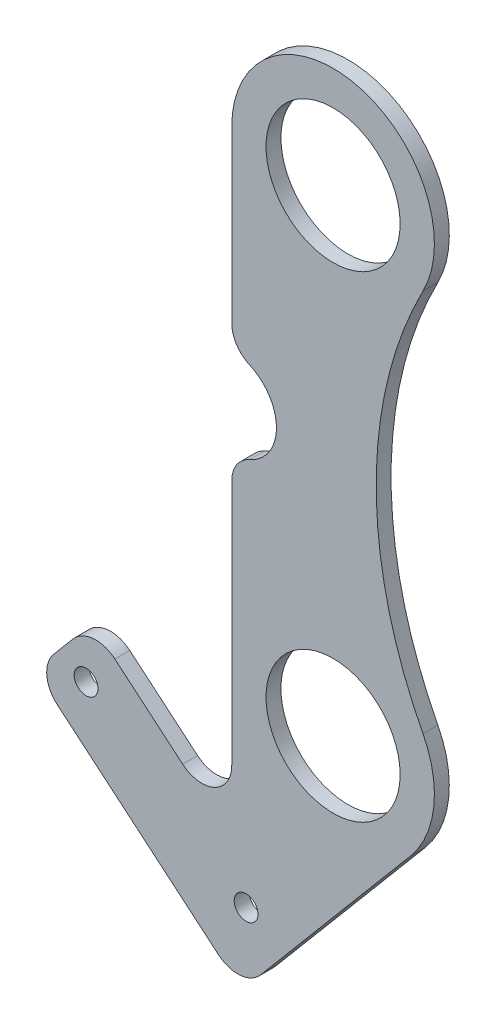
from build123d import *

# Parameters (mm, degrees)
SKETCH1_R           = 14.2875
SKETCH1_R_2         = 2.54
BOSS_EXTRUDE1_DEPTH = 3.175
CUT_EXTRUDE1_DEPTH  = 162.674043733
FILLET3_R           = 6.35
SKETCH3_R           = 2.54
BOSS_EXTRUDE3_DEPTH = 3.175
SKETCH6_R           = 2.54
BOSS_EXTRUDE4_DEPTH = 3.175
FILLET2_R           = 6.35
CUT_EXTRUDE2_DEPTH  = 169.237022961
CUT_EXTRUDE3_DEPTH  = 169.237022961


with BuildPart() as part:
    # Sketch1 → Boss-Extrude1 (new body)
    with BuildSketch(Plane.XY):
        with BuildLine():
            Line((-8.89, 25.4), (8.89, 25.4))
            ThreePointArc((8.89, 25.4), (17.870256121, 21.680256121), (21.59, 12.7))
            Line((21.59, 12.7), (21.59, -117.775079775))
            ThreePointArc((21.59, -117.775079775), (21.127743647, -120.388718212), (19.797058824, -122.685251408))
            Line((19.797058824, -122.685251408), (-7.952696208, -155.616779465))
            ThreePointArc((-7.952696208, -155.616779465), (-12.268297602, -157.851943494), (-16.900388255, -156.380852124))
            Line((-16.900388255, -156.380852124), (-32.439211784, -143.287061102))
            ThreePointArc((-32.439211784, -143.287061102), (-34.674375812, -138.971459708), (-33.203284443, -134.339369055))
            Line((-33.203284443, -134.339369055), (-23.382941176, -122.685251408))
            ThreePointArc((-23.382941176, -122.685251408), (-22.052256353, -120.388718212), (-21.59, -117.775079775))
            Line((-21.59, -117.775079775), (-21.59, 12.7))
            ThreePointArc((-21.59, 12.7), (-17.870256121, 21.680256121), (-8.89, 25.4))
        make_face()
        Circle(SKETCH1_R, mode=Mode.SUBTRACT)
        with Locations((0, -101.6)):
            Circle(SKETCH1_R, mode=Mode.SUBTRACT)
        with Locations((-18.532085478, -142.550133084)):
            Circle(SKETCH1_R_2, mode=Mode.SUBTRACT)
    extrude(amount=BOSS_EXTRUDE1_DEPTH)

    # Sketch2 → Cut-Extrude1 (cut, through all)
    with BuildSketch(Plane.XY):
        with BuildLine():
            ThreePointArc((-21.59, -60.325), (-12.065, -50.8), (-21.59, -41.275))
            Line((-21.59, -41.275), (-21.59, -60.325))
        make_face()
        with BuildLine():
            ThreePointArc((19.159083004, -91.647229609), (21.458203844, -103.981929422), (16.51, -115.512152961))
            Line((16.51, -115.512152961), (-17.501317584, -155.874478972))
            Line((-17.501317584, -155.874478972), (-7.620284479, -163.8572221))
            Line((-7.620284479, -163.8572221), (27.94, -121.656687185))
            Line((27.94, -121.656687185), (27.94, 0))
            Line((27.94, 0), (21.59, 0))
            ThreePointArc((21.59, 0), (20.973467787, -5.122670102), (19.159083004, -9.952770391))
            ThreePointArc((19.159083004, -9.952770391), (9.182340769, -50.8), (19.159083004, -91.647229609))
        make_face()
    extrude(amount=CUT_EXTRUDE1_DEPTH, mode=Mode.SUBTRACT)


with BuildPart() as cut_extrude1_piece_1:
    # of the separate pieces the step leaves, piece 1, a body of its own (cut_extrude1_pieces)
    add(part.part.solids().sort_by_distance((-8.89, 25.4, 0))[0])

    # Fillet3
    fillet3_edges = [cut_extrude1_piece_1.edges().sort_by_distance(p)[0] for p in [
        (-21.59, -41.275, 1.5875),
        (-21.59, -60.325, 1.5875),
    ]]
    fillet(fillet3_edges, radius=FILLET3_R)

    # Sketch3 → Boss-Extrude3 (add)
    with BuildSketch(Plane.XY.offset(3.175)):
        with BuildLine():
            Line((-27.351416194, -127.394768527), (-36.025496499, -137.688579))
            ThreePointArc((-36.025496499, -137.688579), (-37.217489152, -141.441859142), (-35.4063854, -144.93869507))
            Line((-35.4063854, -144.93869507), (-24.403104784, -154.210610454))
            ThreePointArc((-24.403104784, -154.210610454), (-19.771014132, -155.681701823), (-15.455412737, -153.446537795))
            Line((-15.455412737, -153.446537795), (-7.557639641, -144.073996091))
            Line((-7.557639641, -144.073996091), (-27.351416194, -127.394768527))
        make_face()
        with Locations((-18.532085478, -142.550133084)):
            Circle(SKETCH3_R, mode=Mode.SUBTRACT)
    extrude(amount=-BOSS_EXTRUDE3_DEPTH)

    # Sketch6 → Boss-Extrude4 (add)
    with BuildSketch(Plane.XY.offset(3.175)):
        Polygon((-35.4063854, -144.93869507), (-63.620410749, -121.164144113), (-51.344981666, -106.596497054), (-27.065569901, -127.055545526), align=None)
        with Locations((-52.626813855, -117.972130278)):
            Circle(SKETCH6_R, mode=Mode.SUBTRACT)
    extrude(amount=-BOSS_EXTRUDE4_DEPTH)

    # Fillet2
    fillet2_edges = [cut_extrude1_piece_1.edges().sort_by_distance(p)[0] for p in [
        (-63.620410749, -121.164144113, 1.5875),
        (-51.344981666, -106.596497054, 1.5875),
        (-27.065569901, -127.055545526, 1.5875),
    ]]
    fillet(fillet2_edges, radius=FILLET2_R)

    # Sketch7 → Cut-Extrude2 (cut, through all)
    with BuildSketch(Plane.XY.offset(3.175)):
        with BuildLine():
            Line((-21.59, 0), (-21.59, 31.75))
            Line((-21.59, 31.75), (21.59, 31.75))
            Line((21.59, 31.75), (21.59, 0))
            ThreePointArc((21.59, 0), (0, 21.59), (-21.59, 0))
        make_face()
    extrude(amount=-CUT_EXTRUDE2_DEPTH, mode=Mode.SUBTRACT)


with BuildPart() as cut_extrude1_piece_2:
    # of the separate pieces the step leaves, piece 2, a body of its own (cut_extrude1_pieces)
    add(part.part.solids().sort_by_distance((-16.900388255, -156.380852124, 0))[0])


with BuildPart() as cut_extrude3_tool:
    # Sketch10 → Cut-Extrude3 (new, through all)
    with BuildSketch(Plane.XY.offset(3.175)):
        with BuildLine():
            Line((-18.151882461, -155.32628042), (-17.361482582, -157.512020269))
            Line((-17.361482582, -157.512020269), (-14.375706423, -156.432313955))
            Line((-14.375706423, -156.432313955), (-15.455412737, -153.446537795))
            ThreePointArc((-15.455412737, -153.446537795), (-16.679911193, -154.563907595), (-18.151882461, -155.32628042))
        make_face()
    extrude(amount=-CUT_EXTRUDE3_DEPTH)


with BuildPart() as cut_extrude1_piece_1_1:
    add(cut_extrude1_piece_1.part)

    # Cut-Extrude3: cut by cut_extrude3_tool
    add(cut_extrude3_tool.part, mode=Mode.SUBTRACT)


with BuildPart() as cut_extrude1_piece_2_1:
    add(cut_extrude1_piece_2.part)

    # Cut-Extrude3: cut by cut_extrude3_tool
    add(cut_extrude3_tool.part, mode=Mode.SUBTRACT)


solid = cut_extrude1_piece_1_1.part
